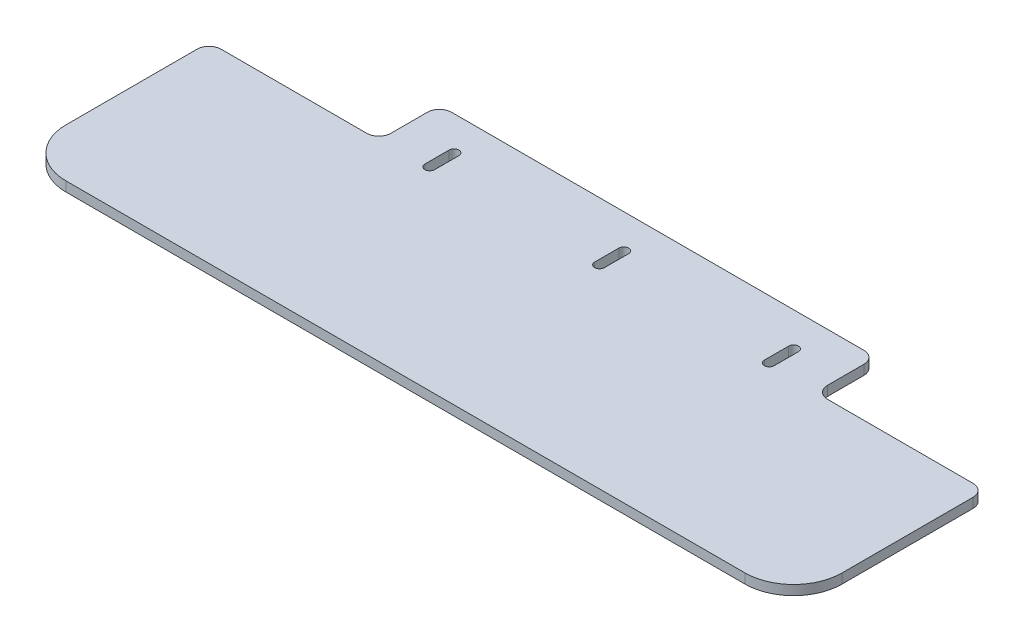
from build123d import *

# Parameters (mm, degrees)
EXTRUDE_1_DEPTH     = 4
SKETCH_2_W          = 70
SKETCH_2_H          = 25
CUT_EXTRUDE_1_DEPTH = 10
FILLET_1_R          = 5
CUT_EXTRUDE_2_DEPTH = 10


with BuildPart() as part:
    # 草图1 → 凸台-拉伸1 (new body)
    with BuildSketch(Plane(origin=(0, 0, 0), x_dir=(1, 0, 0), z_dir=(0, 1, 0))):
        with BuildLine():
            Line((-140, -52), (140, -52))
            ThreePointArc((140, -52), (154.142135624, -46.142135624), (160, -32))
            Line((160, -32), (160, 52))
            Line((160, 52), (-160, 52))
            Line((-160, 52), (-160, -32))
            ThreePointArc((-160, -32), (-154.142135624, -46.142135624), (-140, -52))
        make_face()
    extrude(amount=EXTRUDE_1_DEPTH)

    # 草图2 → 切除-拉伸1 (cut)
    with BuildSketch(Plane.XZ):
        with Locations((-125, -39.5)):
            Rectangle(SKETCH_2_W, SKETCH_2_H)
        with Locations((125, -39.5)):
            Rectangle(SKETCH_2_W, SKETCH_2_H)
    extrude(amount=-CUT_EXTRUDE_1_DEPTH, mode=Mode.SUBTRACT)

    # 圆角1
    fillet_1_edges = [part.edges().sort_by_distance(p)[0] for p in [
        (90, 2, -27),
        (-90, 2, -27),
        (-160, 2, -27),
        (160, 2, -27),
        (90, 2, -52),
        (-90, 2, -52),
    ]]
    fillet(fillet_1_edges, radius=FILLET_1_R)

    # 草图3 → 切除-拉伸2 (cut)
    with BuildSketch(Plane(origin=(0, 4, 0), x_dir=(1, 0, 0), z_dir=(0, 1, 0))):
        with BuildLine():
            Line((2.01, 38), (2.01, 28))
            ThreePointArc((2.01, 28), (0, 25.99), (-2.01, 28))
            Line((-2.01, 28), (-2.01, 38))
            ThreePointArc((-2.01, 38), (0, 40.01), (2.01, 38))
        make_face()
        with BuildLine():
            Line((-72.01, 38), (-72.01, 28))
            ThreePointArc((-72.01, 28), (-70, 25.99), (-67.99, 28))
            Line((-67.99, 28), (-67.99, 38))
            ThreePointArc((-67.99, 38), (-70, 40.01), (-72.01, 38))
        make_face()
        with BuildLine():
            Line((67.99, 38), (67.99, 28))
            ThreePointArc((67.99, 28), (70, 25.99), (72.01, 28))
            Line((72.01, 28), (72.01, 38))
            ThreePointArc((72.01, 38), (70, 40.01), (67.99, 38))
        make_face()
    extrude(amount=-CUT_EXTRUDE_2_DEPTH, mode=Mode.SUBTRACT)


solid = part.part
